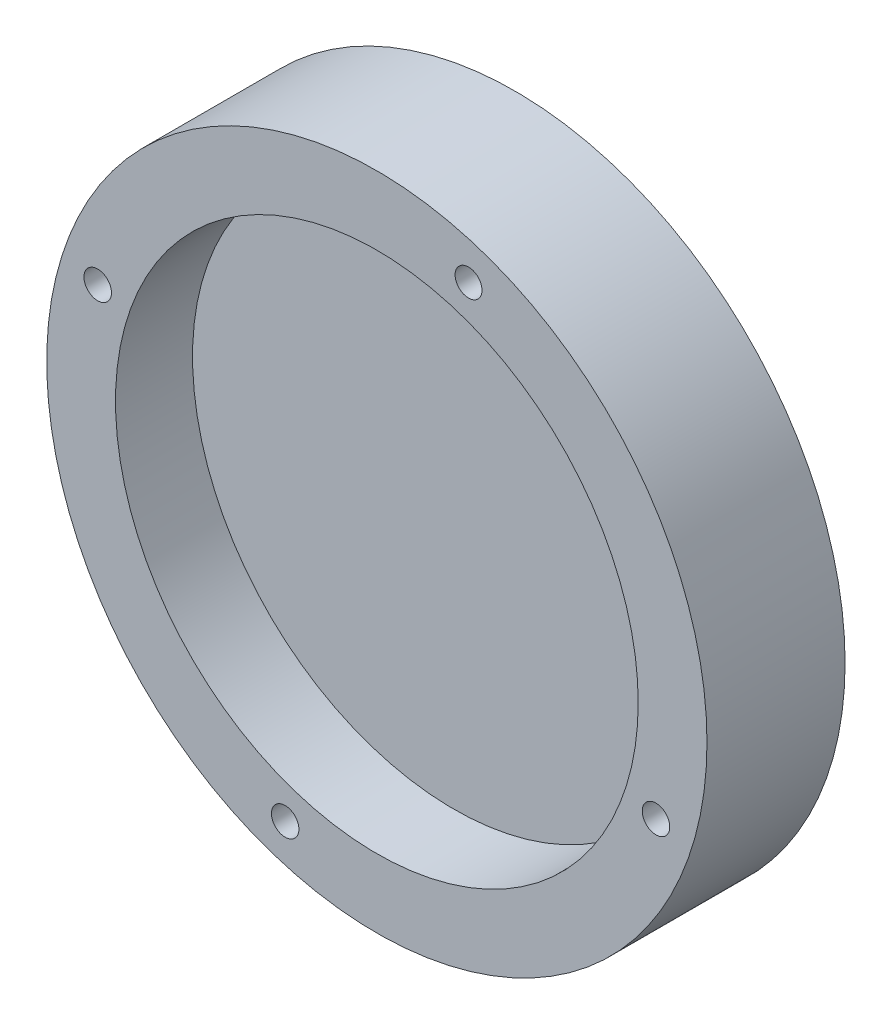
from build123d import *

# Parameters (mm, degrees)
SKETCH1_R               = 60
BOSS_EXTRUDE1_DEPTH     = 25.1
SKETCH3_R               = 47.5
CUT_EXTRUDE2_DEPTH      = 14
CUT_EXTRUDE5_DEPTH      = 89.487343728
CUT_EXTRUDE5_DEPTH_BACK = 89.487343728
SKETCH2_R               = 2.494998654
SKETCH2_R_2             = 2.5
SKETCH2_R_3             = 2.444443829
SKETCH6_R               = 3
CUT_EXTRUDE6_DEPTH      = 6


with BuildPart() as part:
    # Sketch1 → Boss-Extrude1 (new body)
    with BuildSketch(Plane.XY):
        Circle(SKETCH1_R)
    extrude(amount=BOSS_EXTRUDE1_DEPTH)

    # Sketch3 → Cut-Extrude2 (cut)
    with BuildSketch(Plane.XY.offset(25.1)):
        Circle(SKETCH3_R)
    extrude(amount=-CUT_EXTRUDE2_DEPTH, mode=Mode.SUBTRACT)

    # Sketch2 → Cut-Extrude5 (cut, two sides: drawn at the far end of the back side and taken through both)
    with BuildSketch(Plane.XY.offset(25.1).offset(-CUT_EXTRUDE5_DEPTH_BACK)):
        with Locations((-16.664697145, -50.733104448)):
            Circle(SKETCH2_R)
        with Locations((-50.733105114, 16.664696544)):
            Circle(SKETCH2_R_2)
        with Locations((16.664695878, 50.733104512)):
            Circle(SKETCH2_R_3)
        with Locations((50.733103846, -16.66469648)):
            Circle(SKETCH2_R_2)
    extrude(amount=CUT_EXTRUDE5_DEPTH + CUT_EXTRUDE5_DEPTH_BACK, mode=Mode.SUBTRACT)

    # Sketch6 → Cut-Extrude6 (cut)
    with BuildSketch(Plane(origin=(0, 0, 0), x_dir=(-1, 0, 0), z_dir=(0, 0, -1))):
        with Locations((11.973502988, 47.212610548)):
            Circle(SKETCH6_R)
        with Locations((27.381285989, 40.029281029)):
            Circle(SKETCH6_R)
        with Locations((-19.717656658, -20.762902692)):
            Circle(SKETCH6_R)
        with Locations((-4.309873657, -27.946232212)):
            Circle(SKETCH6_R)
    extrude(amount=-CUT_EXTRUDE6_DEPTH, mode=Mode.SUBTRACT)


solid = part.part
